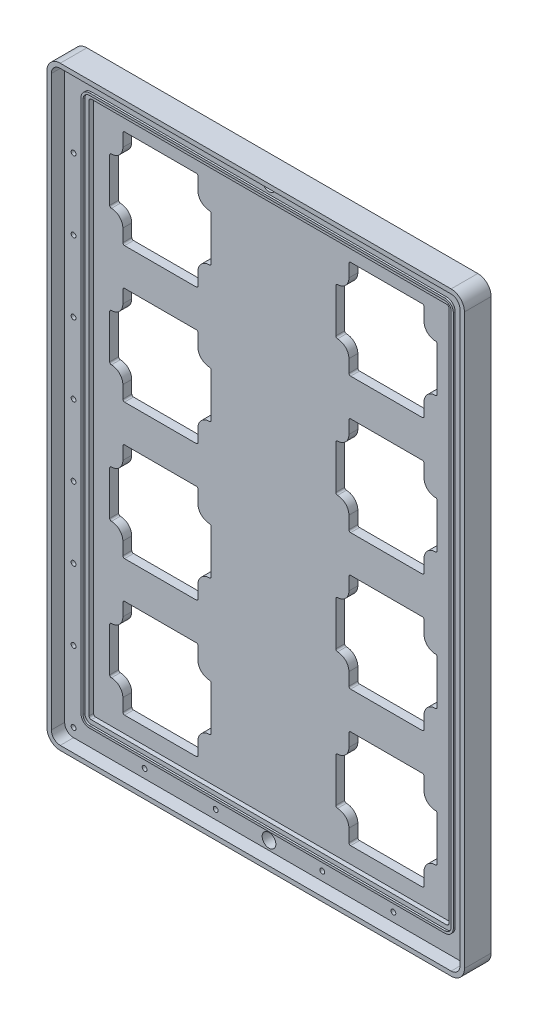
from build123d import *

# Parameters (mm, degrees)
SKETCH1_W            = 292.1
SKETCH1_H            = 419.1
BOSS_EXTRUDE1_DEPTH  = 9.525
SKETCH4_R            = 1.7272
CUT_EXTRUDE1_DEPTH   = 6.985
LPATTERN2_COUNT      = 8
LPATTERN2_PITCH      = 50.8
CUT_EXTRUDE3_DEPTH   = 3.175
BOSS_EXTRUDE2_DEPTH  = 1.3335
FILLET1_R            = 6.35
CUT_EXTRUDE5_DEPTH   = 3.175
CUT_EXTRUDE6_DEPTH   = 511.964898033
SKETCH11_R           = 1.1303
CUT_EXTRUDE7_DEPTH   = 3.96875
LPATTERN1_COUNT      = 2
LPATTERN1_PITCH      = 161.5948
LPATTERN1_COUNT_DIR2 = 4
LPATTERN1_PITCH_DIR2 = 96.8756
BOSS_EXTRUDE5_START  = -19.05
BOSS_EXTRUDE5_DEPTH  = 19.05
SKETCH14_R           = 1.7272
CUT_EXTRUDE8_DEPTH   = 6.985
SKETCH15_R           = 4.9022
CUT_EXTRUDE9_DEPTH   = 516.358348021
LPATTERN3_COUNT      = 2
LPATTERN3_PITCH      = 406.4


with BuildPart() as part:
    # Sketch1 → Boss-Extrude1 (new body)
    with BuildSketch(Plane.XY):
        with Locations((146.05, 209.55)):
            Rectangle(SKETCH1_W, SKETCH1_H)
    extrude(amount=BOSS_EXTRUDE1_DEPTH)

    # Sketch4 → Cut-Extrude1 (cut)
    with BuildSketch(Plane.XY.offset(9.525)):
        with Locations((6.35, 6.35)):
            Circle(SKETCH4_R)
        with Locations((6.35, 412.75)):
            Circle(SKETCH4_R)
        with Locations((285.75, 412.75)):
            Circle(SKETCH4_R)
        with Locations((285.75, 6.35)):
            Circle(SKETCH4_R)
    cut_extrude1 = extrude(amount=-CUT_EXTRUDE1_DEPTH, mode=Mode.SUBTRACT)

    # LPattern2: Cut-Extrude1 ×8
    with Locations(*[(0, -i * LPATTERN2_PITCH, 0) for i in range(1, LPATTERN2_COUNT)]):
        add(cut_extrude1, mode=Mode.SUBTRACT)

    # Sketch6 → Cut-Extrude3 (cut)
    with BuildSketch(Plane.XY.offset(9.525)):
        with BuildLine():
            Line((273.05, 401.6375), (19.05, 401.6375))
            ThreePointArc((19.05, 401.6375), (17.927467985, 401.172532015), (17.4625, 400.05))
            Line((17.4625, 400.05), (17.4625, 19.05))
            ThreePointArc((17.4625, 19.05), (17.927467985, 17.927467985), (19.05, 17.4625))
            Line((19.05, 17.4625), (273.05, 17.4625))
            ThreePointArc((273.05, 17.4625), (274.172532015, 17.927467985), (274.6375, 19.05))
            Line((274.6375, 19.05), (274.6375, 400.05))
            ThreePointArc((274.6375, 400.05), (274.172532015, 401.172532015), (273.05, 401.6375))
        make_face()
    extrude(amount=-CUT_EXTRUDE3_DEPTH, mode=Mode.SUBTRACT)

    # Sketch5 → Boss-Extrude2 (add)
    with BuildSketch(Plane.XY.offset(9.525)):
        with BuildLine():
            ThreePointArc((19.05, 406.146), (14.739477062, 404.360522938), (12.954, 400.05))
            Line((12.954, 400.05), (12.954, 19.05))
            ThreePointArc((12.954, 19.05), (14.739477062, 14.739477062), (19.05, 12.954))
            Line((19.05, 12.954), (273.05, 12.954))
            ThreePointArc((273.05, 12.954), (277.360522938, 14.739477062), (279.146, 19.05))
            Line((279.146, 19.05), (279.146, 400.05))
            ThreePointArc((279.146, 400.05), (277.360522938, 404.360522938), (273.05, 406.146))
            Line((273.05, 406.146), (19.05, 406.146))
        make_face()
        with BuildLine():
            ThreePointArc((273.05, 404.622), (276.282892204, 403.282892204), (277.622, 400.05))
            Line((277.622, 400.05), (277.622, 19.05))
            ThreePointArc((277.622, 19.05), (276.282892204, 15.817107796), (273.05, 14.478))
            Line((273.05, 14.478), (19.05, 14.478))
            ThreePointArc((19.05, 14.478), (15.817107796, 15.817107796), (14.478, 19.05))
            Line((14.478, 19.05), (14.478, 400.05))
            ThreePointArc((14.478, 400.05), (15.817107796, 403.282892204), (19.05, 404.622))
            Line((19.05, 404.622), (273.05, 404.622))
        make_face(mode=Mode.SUBTRACT)
    extrude(amount=BOSS_EXTRUDE2_DEPTH)

    # Fillet1
    fillet1_edges = [part.edges().sort_by_distance(p)[0] for p in [
        (0, 419.1, 4.7625),
        (292.1, 419.1, 4.7625),
        (0, 0, 4.7625),
        (292.1, 0, 4.7625),
    ]]
    fillet(fillet1_edges, radius=FILLET1_R)

    # Sketch8 → Cut-Extrude5 (cut)
    with BuildSketch(Plane(origin=(0, 0, 0), x_dir=(-1, 0, 0), z_dir=(0, 0, -1))):
        with BuildLine():
            Line((-201.2442, 393.7), (-252.4506, 393.7))
            ThreePointArc((-252.4506, 393.7), (-255.881057838, 392.279057838), (-257.302, 388.8486))
            Line((-257.302, 388.8486), (-257.302, 379.857))
            ThreePointArc((-257.302, 379.857), (-258.633668309, 376.642068309), (-261.8486, 375.3104))
            ThreePointArc((-261.8486, 375.3104), (-265.279057838, 373.889457838), (-266.7, 370.459))
            Line((-266.7, 370.459), (-266.7, 339.2678))
            ThreePointArc((-266.7, 339.2678), (-265.279057838, 335.837342162), (-261.8486, 334.4164))
            ThreePointArc((-261.8486, 334.4164), (-258.633668309, 333.084731691), (-257.302, 329.8698))
            Line((-257.302, 329.8698), (-257.302, 320.8782))
            ThreePointArc((-257.302, 320.8782), (-255.881057838, 317.447742162), (-252.4506, 316.0268))
            Line((-252.4506, 316.0268), (-201.2442, 316.0268))
            ThreePointArc((-201.2442, 316.0268), (-197.813742162, 317.447742162), (-196.3928, 320.8782))
            Line((-196.3928, 320.8782), (-196.3928, 329.8698))
            ThreePointArc((-196.3928, 329.8698), (-195.061131691, 333.084731691), (-191.8462, 334.4164))
            ThreePointArc((-191.8462, 334.4164), (-188.415742162, 335.837342162), (-186.9948, 339.2678))
            Line((-186.9948, 339.2678), (-186.9948, 370.459))
            ThreePointArc((-186.9948, 370.459), (-188.415742162, 373.889457838), (-191.8462, 375.3104))
            ThreePointArc((-191.8462, 375.3104), (-195.061131691, 376.642068309), (-196.3928, 379.857))
            Line((-196.3928, 379.857), (-196.3928, 388.8486))
            ThreePointArc((-196.3928, 388.8486), (-197.813742162, 392.279057838), (-201.2442, 393.7))
        make_face()
        with BuildLine():
            Line((-264.668, 370.459), (-264.668, 339.2678))
            ThreePointArc((-264.668, 339.2678), (-263.842216859, 337.274183141), (-261.8486, 336.4484))
            ThreePointArc((-261.8486, 336.4484), (-257.196827329, 334.521572671), (-255.27, 329.8698))
            Line((-255.27, 329.8698), (-255.27, 320.8782))
            ThreePointArc((-255.27, 320.8782), (-254.444216859, 318.884583141), (-252.4506, 318.0588))
            Line((-252.4506, 318.0588), (-201.2442, 318.0588))
            ThreePointArc((-201.2442, 318.0588), (-199.250583141, 318.884583141), (-198.4248, 320.8782))
            Line((-198.4248, 320.8782), (-198.4248, 329.8698))
            ThreePointArc((-198.4248, 329.8698), (-196.497972671, 334.521572671), (-191.8462, 336.4484))
            ThreePointArc((-191.8462, 336.4484), (-189.852583141, 337.274183141), (-189.0268, 339.2678))
            Line((-189.0268, 339.2678), (-189.0268, 370.459))
            ThreePointArc((-189.0268, 370.459), (-189.852583141, 372.452616859), (-191.8462, 373.2784))
            ThreePointArc((-191.8462, 373.2784), (-196.497972671, 375.205227329), (-198.4248, 379.857))
            Line((-198.4248, 379.857), (-198.4248, 388.8486))
            ThreePointArc((-198.4248, 388.8486), (-199.250583141, 390.842216859), (-201.2442, 391.668))
            Line((-201.2442, 391.668), (-252.4506, 391.668))
            ThreePointArc((-252.4506, 391.668), (-254.444216859, 390.842216859), (-255.27, 388.8486))
            Line((-255.27, 388.8486), (-255.27, 379.857))
            ThreePointArc((-255.27, 379.857), (-257.196827329, 375.205227329), (-261.8486, 373.2784))
            ThreePointArc((-261.8486, 373.2784), (-263.842216859, 372.452616859), (-264.668, 370.459))
        make_face(mode=Mode.SUBTRACT)
    cut_extrude5 = extrude(amount=-CUT_EXTRUDE5_DEPTH, mode=Mode.SUBTRACT)

    # Sketch10 → Cut-Extrude6 (cut, through all)
    with BuildSketch(Plane(origin=(0, 0, 0), x_dir=(-1, 0, 0), z_dir=(0, 0, -1))):
        with BuildLine():
            Line((-263.0805, 370.459), (-263.0805, 339.2678))
            ThreePointArc((-263.0805, 339.2678), (-262.719684844, 338.396715156), (-261.8486, 338.0359))
            ThreePointArc((-261.8486, 338.0359), (-256.074295314, 335.644104686), (-253.6825, 329.8698))
            Line((-253.6825, 329.8698), (-253.6825, 320.8782))
            ThreePointArc((-253.6825, 320.8782), (-253.321684844, 320.007115156), (-252.4506, 319.6463))
            Line((-252.4506, 319.6463), (-201.2442, 319.6463))
            ThreePointArc((-201.2442, 319.6463), (-200.373115156, 320.007115156), (-200.0123, 320.8782))
            Line((-200.0123, 320.8782), (-200.0123, 329.8698))
            ThreePointArc((-200.0123, 329.8698), (-197.620504686, 335.644104686), (-191.8462, 338.0359))
            ThreePointArc((-191.8462, 338.0359), (-190.975115156, 338.396715156), (-190.6143, 339.2678))
            Line((-190.6143, 339.2678), (-190.6143, 370.459))
            ThreePointArc((-190.6143, 370.459), (-190.975115156, 371.330084844), (-191.8462, 371.6909))
            ThreePointArc((-191.8462, 371.6909), (-197.620504686, 374.082695314), (-200.0123, 379.857))
            Line((-200.0123, 379.857), (-200.0123, 388.8486))
            ThreePointArc((-200.0123, 388.8486), (-200.373115156, 389.719684844), (-201.2442, 390.0805))
            Line((-201.2442, 390.0805), (-252.4506, 390.0805))
            ThreePointArc((-252.4506, 390.0805), (-253.321684844, 389.719684844), (-253.6825, 388.8486))
            Line((-253.6825, 388.8486), (-253.6825, 379.857))
            ThreePointArc((-253.6825, 379.857), (-256.074295314, 374.082695314), (-261.8486, 371.6909))
            ThreePointArc((-261.8486, 371.6909), (-262.719684844, 371.330084844), (-263.0805, 370.459))
        make_face()
    cut_extrude6 = extrude(amount=-CUT_EXTRUDE6_DEPTH, mode=Mode.SUBTRACT)

    # Sketch11 → Cut-Extrude7 (cut)
    with BuildSketch(Plane(origin=(0, 0, 0), x_dir=(-1, 0, 0), z_dir=(0, 0, -1))):
        with Locations((-261.8486, 388.8994)):
            Circle(SKETCH11_R)
        with Locations((-191.8462, 388.8994)):
            Circle(SKETCH11_R)
        with Locations((-191.8462, 320.8274)):
            Circle(SKETCH11_R)
        with Locations((-261.8486, 320.8274)):
            Circle(SKETCH11_R)
    cut_extrude7 = extrude(amount=-CUT_EXTRUDE7_DEPTH, mode=Mode.SUBTRACT)

    # LPattern1: Cut-Extrude5, Cut-Extrude6, Cut-Extrude7 2 × 4
    with Locations(*[(-i * LPATTERN1_PITCH, -j * LPATTERN1_PITCH_DIR2, 0) for i in range(LPATTERN1_COUNT) for j in range(LPATTERN1_COUNT_DIR2) if (i, j) != (0, 0)]):
        add(cut_extrude5, mode=Mode.SUBTRACT)
        add(cut_extrude6, mode=Mode.SUBTRACT)
        add(cut_extrude7, mode=Mode.SUBTRACT)

    # Sketch13 → Boss-Extrude5 (add)
    with BuildSketch(Plane(origin=(0, 0, 0), x_dir=(-1, 0, 0), z_dir=(0, 0, -1)).offset(BOSS_EXTRUDE5_START)):
        with BuildLine():
            Line((-285.75, -3.175), (-6.35, -3.175))
            ThreePointArc((-6.35, -3.175), (0.385192091, -0.385192091), (3.175, 6.35))
            Line((3.175, 6.35), (3.175, 412.75))
            ThreePointArc((3.175, 412.75), (0.385192091, 419.485192091), (-6.35, 422.275))
            Line((-6.35, 422.275), (-285.75, 422.275))
            ThreePointArc((-285.75, 422.275), (-292.485192091, 419.485192091), (-295.275, 412.75))
            Line((-295.275, 412.75), (-295.275, 6.35))
            ThreePointArc((-295.275, 6.35), (-292.485192091, -0.385192091), (-285.75, -3.175))
        make_face()
        with BuildLine():
            Line((-6.35, 419.1), (-285.75, 419.1))
            ThreePointArc((-285.75, 419.1), (-290.240128061, 417.240128061), (-292.1, 412.75))
            Line((-292.1, 412.75), (-292.1, 6.35))
            ThreePointArc((-292.1, 6.35), (-290.240128061, 1.859871939), (-285.75, 0))
            Line((-285.75, 0), (-6.35, 0))
            ThreePointArc((-6.35, 0), (-1.859871939, 1.859871939), (0, 6.35))
            Line((0, 6.35), (0, 412.75))
            ThreePointArc((0, 412.75), (-1.859871939, 417.240128061), (-6.35, 419.1))
        make_face(mode=Mode.SUBTRACT)
    extrude(amount=BOSS_EXTRUDE5_DEPTH)

    # Sketch14 → Cut-Extrude8 (cut)
    with BuildSketch(Plane.XY.offset(9.525)):
        with Locations((234.95, 6.35)):
            Circle(SKETCH14_R)
        with Locations((184.15, 6.35)):
            Circle(SKETCH14_R)
        with Locations((107.95, 6.35)):
            Circle(SKETCH14_R)
        with Locations((57.15, 6.35)):
            Circle(SKETCH14_R)
    cut_extrude8 = extrude(amount=-CUT_EXTRUDE8_DEPTH, mode=Mode.SUBTRACT)

    # Sketch15 → Cut-Extrude9 (cut, through all)
    with BuildSketch(Plane.XY.offset(9.525)):
        with Locations((146.05, 6.35)):
            Circle(SKETCH15_R)
    cut_extrude9 = extrude(amount=-CUT_EXTRUDE9_DEPTH, mode=Mode.SUBTRACT)

    # LPattern3: Cut-Extrude8, Cut-Extrude9 ×2
    with Locations(*[(0, i * LPATTERN3_PITCH, 0) for i in range(1, LPATTERN3_COUNT)]):
        add(cut_extrude8, mode=Mode.SUBTRACT)
        add(cut_extrude9, mode=Mode.SUBTRACT)


solid = part.part
